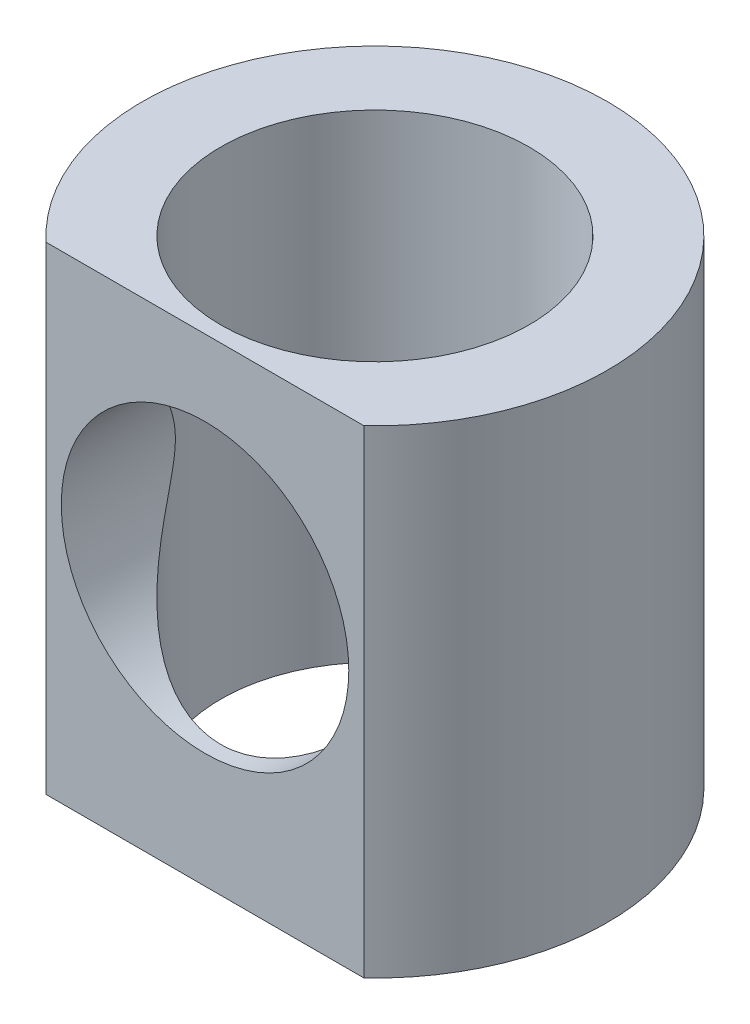
from build123d import *

# Parameters (mm, degrees)
SKETCH1_R               = 8.9
SKETCH1_R_2             = 5.9
BOSS_EXTRUDE1_DEPTH     = 18.3
CUT_EXTRUDE5_START      = 6.5
SKETCH3_R               = 7.65
CUT_EXTRUDE5_DEPTH      = 16.710583063
SKETCH7_R               = 16.725120467
CUT_EXTRUDE7_DEPTH      = 10
CUT_EXTRUDE6_DEPTH      = 26.519796237
CUT_EXTRUDE6_DEPTH_BACK = 7
SKETCH6_R               = 5.5


with BuildPart() as part:
    # Sketch1 → Boss-Extrude1 (new body)
    with BuildSketch(Plane(origin=(0, 0, 0), x_dir=(1, 0, 0), z_dir=(0, 1, 0))):
        Circle(SKETCH1_R)
        Circle(SKETCH1_R_2, mode=Mode.SUBTRACT)
    extrude(amount=-BOSS_EXTRUDE1_DEPTH)

    # Sketch3 → Cut-Extrude5 (cut, through all)
    with BuildSketch(Plane.XY.offset(CUT_EXTRUDE5_START)):
        with Locations((0, -8.4)):
            Circle(SKETCH3_R)
    extrude(amount=CUT_EXTRUDE5_DEPTH, mode=Mode.SUBTRACT)

    # Sketch7 → Cut-Extrude7 (cut)
    with BuildSketch(Plane.XY.offset(6.5)):
        with Locations((0, -8.631699389)):
            Circle(SKETCH7_R)
    extrude(amount=CUT_EXTRUDE7_DEPTH, mode=Mode.SUBTRACT)

    # Sketch6 → Cut-Extrude6 (cut, two sides: drawn at the far end of the back side and taken through both)
    with BuildSketch(Plane.XY.offset(6.5).offset(-CUT_EXTRUDE6_DEPTH_BACK)):
        with Locations((0, -8.4)):
            Circle(SKETCH6_R)
    extrude(amount=CUT_EXTRUDE6_DEPTH + CUT_EXTRUDE6_DEPTH_BACK, mode=Mode.SUBTRACT)


solid = part.part
